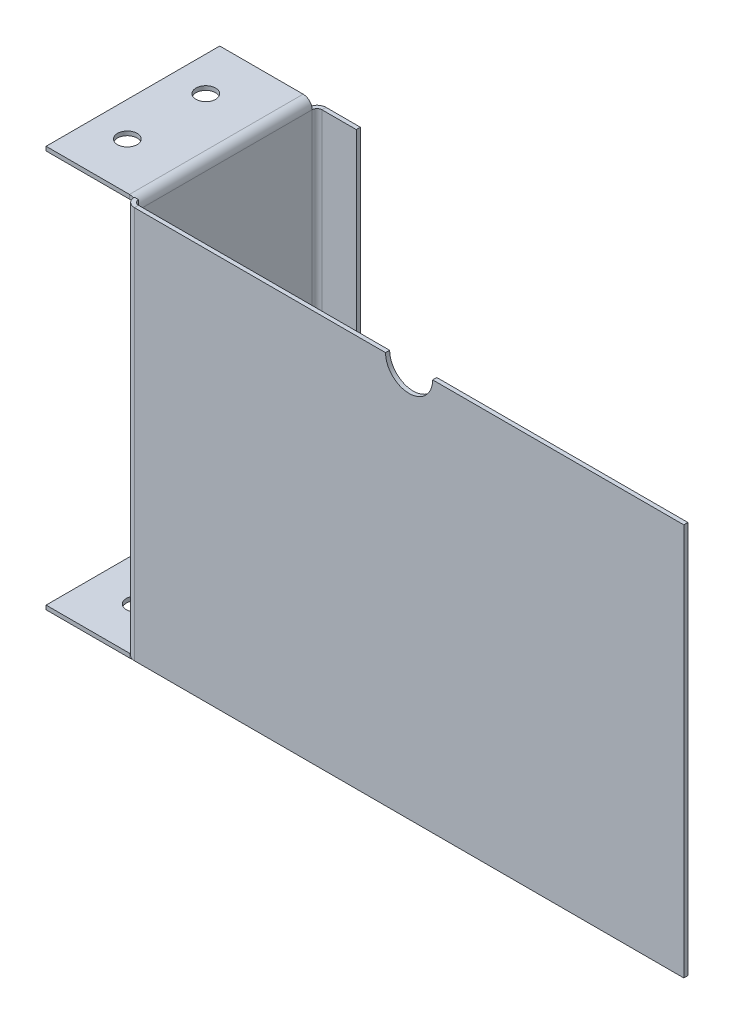
from build123d import *

# Parameters (mm, degrees)
BASE_FLANGE1_DEPTH           = 2.65684
EDGE_FLANGE1_DEPTH           = 254
EDGE_FLANGE2_STRIP_W         = 16.97736
EDGE_FLANGE2_STRIP_H         = 2.65684
EDGE_FLANGE2_STRIP_CUT_DEPTH = 112.395
EDGE_FLANGE2_DEPTH           = 112.395
EDGE_FLANGE3_DEPTH           = 112.395
EDGE_FLANGE4_DEPTH           = 248.16816
SKETCH22_R                   = 6.35
CUT_EXTRUDE1_DEPTH           = 2.65684
SKETCH23_R                   = 6.35
CUT_EXTRUDE2_DEPTH           = 2.65684
SKETCH24_R                   = 6.35
CUT_EXTRUDE3_DEPTH           = 2.65684


# Sheet-metal steps are written as plain solids
with BuildPart() as part:
    # Sketch1 → Base-Flange1 (new body)
    with BuildSketch(Plane.XY):
        with BuildLine():
            Line((0, 0), (355.6, 0))
            Line((355.6, 0), (355.6, 254))
            Line((355.6, 254), (193.04, 254))
            ThreePointArc((193.04, 254), (177.8, 238.76), (162.56, 254))
            Line((162.56, 254), (0, 254))
            Line((0, 254), (0, 0))
        make_face()
    extrude(amount=-BASE_FLANGE1_DEPTH)

    # Edge-Flange1 section (across the edge) → Edge-Flange1 (add)
    with BuildSketch(Plane(origin=(-3.175, 0, -2.65684), x_dir=(1, 0, 0), z_dir=(0, 1, 0))):
        with BuildLine():
            Line((-2.65684, 3.175), (-2.65684, 115.57))
            Line((-2.65684, 115.57), (0, 115.57))
            Line((0, 115.57), (0, 3.175))
            ThreePointArc((0, 3.175), (0.92993597, 0.92993597), (3.175, 0))
            Line((3.175, 0), (3.175, -2.65684))
            ThreePointArc((3.175, -2.65684), (-0.948733611, -0.948733611), (-2.65684, 3.175))
        make_face()
    extrude(amount=EDGE_FLANGE1_DEPTH)

    # Edge-Flange2 strip (across the edge) → Edge-Flange2 strip cut (cut)
    with BuildSketch(Plane(origin=(-5.83184, 254, -5.83184), x_dir=(0, -1, 0), z_dir=(0, 0, -1))):
        with Locations((-2.65684, -1.32842)):
            Rectangle(EDGE_FLANGE2_STRIP_W, EDGE_FLANGE2_STRIP_H)
    extrude(amount=EDGE_FLANGE2_STRIP_CUT_DEPTH, mode=Mode.SUBTRACT)

    # Edge-Flange2 section (across the edge) → Edge-Flange2 (add)
    with BuildSketch(Plane(origin=(-5.83184, 254, -5.83184), x_dir=(0, -1, 0), z_dir=(0, 0, -1))):
        with BuildLine():
            Line((0, 3.175), (0, 57.15))
            Line((0, 57.15), (2.65684, 57.15))
            Line((2.65684, 57.15), (2.65684, 3.175))
            ThreePointArc((2.65684, 3.175), (3.58677597, 0.92993597), (5.83184, 0))
            Line((5.83184, 0), (5.83184, -2.65684))
            ThreePointArc((5.83184, -2.65684), (1.708106389, -0.948733611), (0, 3.175))
        make_face()
    extrude(amount=EDGE_FLANGE2_DEPTH)

    # Edge-Flange3 section (across the edge) → Edge-Flange3 (add)
    with BuildSketch(Plane(origin=(-5.83184, -3.175, -118.22684), x_dir=(0, 1, 0), z_dir=(0, 0, 1))):
        with BuildLine():
            Line((-2.65684, 3.175), (-2.65684, 57.15))
            Line((-2.65684, 57.15), (0, 57.15))
            Line((0, 57.15), (0, 3.175))
            ThreePointArc((0, 3.175), (0.92993597, 0.92993597), (3.175, 0))
            Line((3.175, 0), (3.175, -2.65684))
            ThreePointArc((3.175, -2.65684), (-0.948733611, -0.948733611), (-2.65684, 3.175))
        make_face()
    extrude(amount=EDGE_FLANGE3_DEPTH)

    # Edge-Flange4 section (across the edge) → Edge-Flange4 (add)
    with BuildSketch(Plane(origin=(-3.175, 0, -121.40184), x_dir=(0, 0, 1), z_dir=(0, 1, 0))):
        with BuildLine():
            Line((-2.65684, 3.175), (-2.65684, 25.4))
            Line((-2.65684, 25.4), (0, 25.4))
            Line((0, 25.4), (0, 3.175))
            ThreePointArc((0, 3.175), (0.92993597, 0.92993597), (3.175, 0))
            Line((3.175, 0), (3.175, -2.65684))
            ThreePointArc((3.175, -2.65684), (-0.948733611, -0.948733611), (-2.65684, 3.175))
        make_face()
    extrude(amount=EDGE_FLANGE4_DEPTH)

    # Sketch22 → Cut-Extrude1 (cut)
    with BuildSketch(Plane(origin=(0, 254, 0), x_dir=(1, 0, 0), z_dir=(0, 1, 0))):
        with Locations(Location((-40.76446, 86.995, 0), (0, 0, 180))):
            Circle(SKETCH22_R)
        with Locations(Location((-40.76446, 36.195, 0), (0, 0, 180))):
            Circle(SKETCH22_R)
    extrude(amount=-CUT_EXTRUDE1_DEPTH, mode=Mode.SUBTRACT)

    # Sketch23 → Cut-Extrude2 (cut)
    with BuildSketch(Plane(origin=(0, -3.175, 0), x_dir=(1, 0, 0), z_dir=(0, 1, 0))):
        with Locations(Location((-34.40684, 86.36, 0), (0, 0, 180))):
            Circle(SKETCH23_R)
        with Locations(Location((-34.40684, 35.56, 0), (0, 0, 180))):
            Circle(SKETCH23_R)
    extrude(amount=-CUT_EXTRUDE2_DEPTH, mode=Mode.SUBTRACT)

    # Sketch24 → Cut-Extrude3 (cut)
    with BuildSketch(Plane.ZY.offset(5.83184)):
        with Locations((-86.995, 41.79316)):
            Circle(SKETCH24_R)
        with Locations((-34.40684, 41.79316)):
            Circle(SKETCH24_R)
    extrude(amount=-CUT_EXTRUDE3_DEPTH, mode=Mode.SUBTRACT)


solid = part.part
